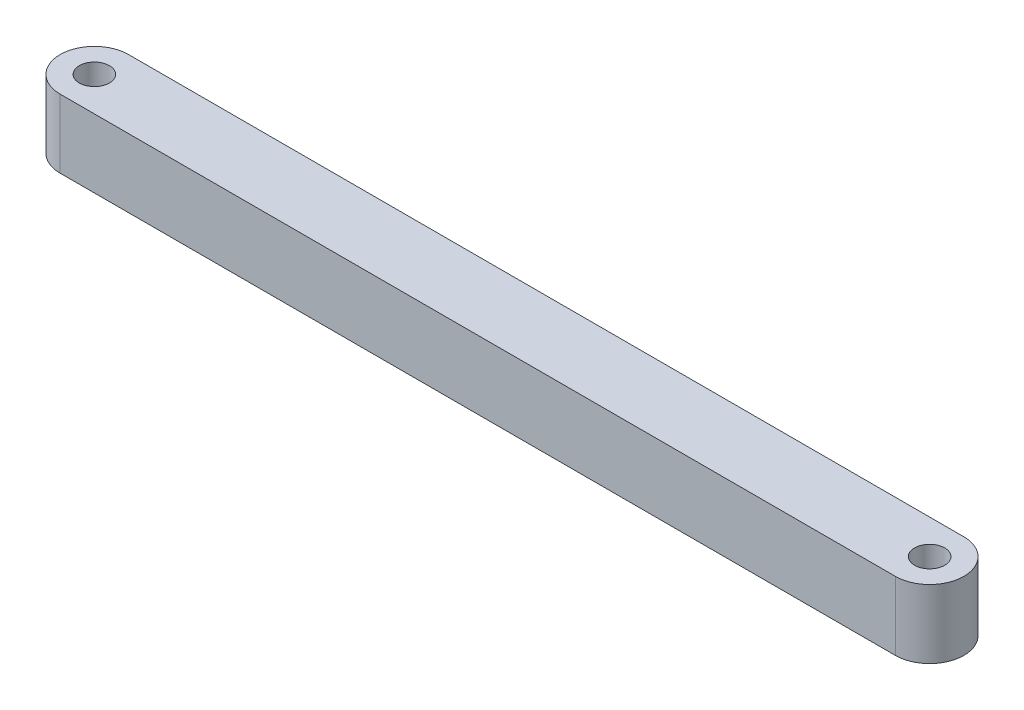
from build123d import *

# Parameters (mm, degrees)
SKETCH1_R           = 1.1
BOSS_EXTRUDE1_DEPTH = 5


with BuildPart() as part:
    # Sketch1 → Boss-Extrude1 (new body)
    with BuildSketch(Plane(origin=(0, 0, 0), x_dir=(1, 0, 0), z_dir=(0, 1, 0))):
        with BuildLine():
            Line((-58.7, 2.5), (2.27, 2.5))
            ThreePointArc((2.27, 2.5), (4.77, 0), (2.27, -2.5))
            Line((2.27, -2.5), (-58.7, -2.5))
            ThreePointArc((-58.7, -2.5), (-61.2, 0), (-58.7, 2.5))
        make_face()
        with Locations((2.27, 0)):
            Circle(SKETCH1_R, mode=Mode.SUBTRACT)
        with Locations((-58.7, 0)):
            Circle(SKETCH1_R, mode=Mode.SUBTRACT)
    extrude(amount=BOSS_EXTRUDE1_DEPTH)


solid = part.part
